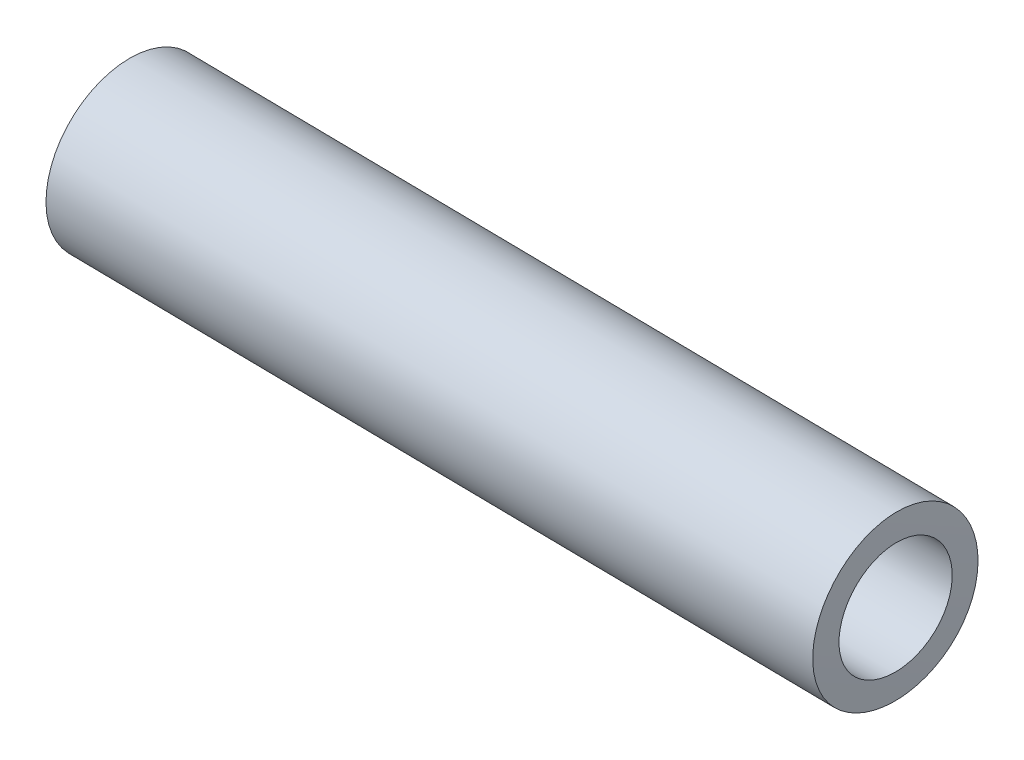
from build123d import *

# Parameters (mm, degrees)
SWEEP_SOTTILE1_PROFILE_R   = 3.175
SWEEP_SOTTILE1_PROFILE_R_2 = 2.175
BOSS_EXTRUDE1_OUTLINE_R    = 3.175
BOSS_EXTRUDE1_OUTLINE_R_2  = 2.175
BOSS_EXTRUDE1_DEPTH        = 14.238780227
BOSS_EXTRUDE1_START        = -4
BOSS_EXTRUDE1_2_DEPTH      = 8


with BuildPart() as part:
    # Sweep-Sottile1: sweep along a path in Schizzo1
    with BuildLine(Plane.XY) as sweep_sottile1_path:
        Line((0, 0), (15.23854919, -0.210282187))
    # Sweep-Sottile1 profile (on start of the path) → Sweep-Sottile1 (sweep)
    with BuildSketch(Plane(origin=(0, 0, 0), x_dir=(0.013798043774195348, 0.9999048024627172, 0), z_dir=(0.9999048024627172, -0.013798043774195348, 0))):
        Circle(SWEEP_SOTTILE1_PROFILE_R)
        Circle(SWEEP_SOTTILE1_PROFILE_R_2, mode=Mode.SUBTRACT)
    sweep(path=sweep_sottile1_path.line)

    # Boss-Extrude1: read off the stored shape, not the designer's step
    # Boss-Extrude1 outline → Boss-Extrude1 (add)
    with BuildSketch(Plane(origin=(15.23854919, -0.210282187, 0), x_dir=(-0.013798043774230273, -0.9999048024627166, 0), z_dir=(0.9999048024627166, -0.013798043774230273, 0))):
        Circle(BOSS_EXTRUDE1_OUTLINE_R)
        Circle(BOSS_EXTRUDE1_OUTLINE_R_2, mode=Mode.SUBTRACT)
    extrude(amount=BOSS_EXTRUDE1_DEPTH)

    # Boss-Extrude1 2 outline → Boss-Extrude1 2 (cut)
    with BuildSketch(Plane(origin=(0, 0, 0), x_dir=(0.9999776358196223, -0.0032413727320758433, -0.005849902854796434), z_dir=(0.006687889098871204, 0.48465221140979525, 0.8746813740528584)).offset(BOSS_EXTRUDE1_START)):
        with BuildLine():
            ThreePointArc((29.476633089, -0.355783952), (29.439947675, -1.943650915), (29.36824562, -3.530322313))
            Line((29.36824562, -3.530322313), (29.285578099, -5))
            Line((29.285578099, -5), (29.420577266, -5))
            Line((29.420577266, -5), (29.438313552, -3.530552917))
            Line((29.438313552, -3.530552917), (29.476633089, -0.355783952))
        make_face()
        with BuildLine():
            ThreePointArc((29.444899899, 2.8204373), (29.47828405, 1.23250169), (29.476633089, -0.355783952))
            Line((29.476633089, -0.355783952), (29.514952729, 2.818984581))
            Line((29.514952729, 2.818984581), (29.529207633, 4))
            Line((29.529207633, 4), (29.40708136, 4))
            Line((29.40708136, 4), (29.444899899, 2.8204373))
        make_face()
    extrude(amount=BOSS_EXTRUDE1_2_DEPTH, mode=Mode.SUBTRACT)


solid = part.part
